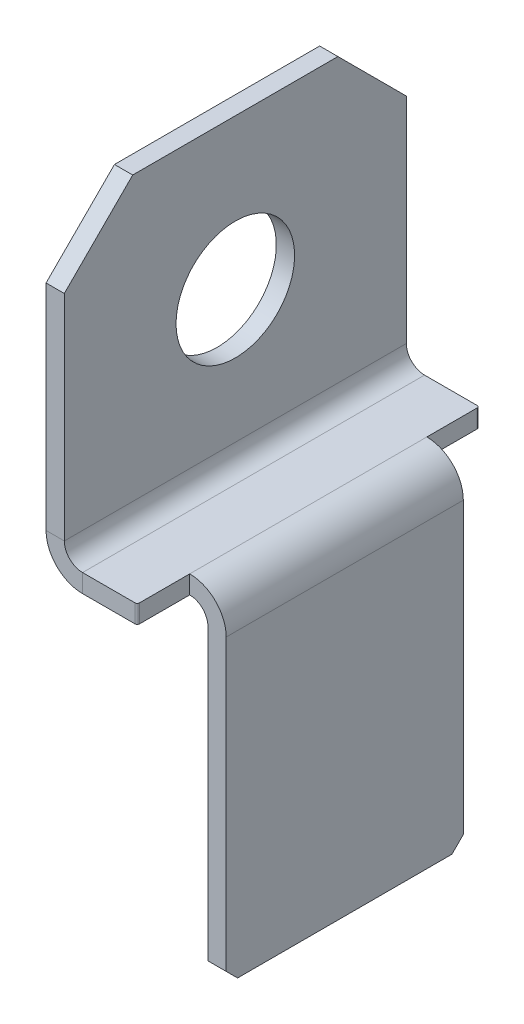
from build123d import *

# Parameters (mm, degrees)
ODGI_CIE_BAZOWE1_DEPTH          = 15
WYTNIJ_WYCI_GNI_CIE1_DEPTH      = 33.254612073
WYTNIJ_WYCI_GNI_CIE1_DEPTH_BACK = 1.6
SZKIC6_W                        = 2.3
SZKIC6_H                        = 1.6
SZKIC6_H_2                      = 13.2
WYTNIJ_WYCI_GNI_CIE2_REACH      = 34.255
SZKIC7_R                        = 2.6
SFAZOWANIE1_SIZE                = 3
ZAOKR_GLENIE1_R                 = 0.1
SFAZOWANIE2_SIZE                = 0.5


# Sheet-metal steps are written as plain solids
with BuildPart() as part:
    # Szkic1 → Odgięcie bazowe1 (new body)
    with BuildSketch(Plane.XY):
        with BuildLine():
            Line((0, 0), (0, 13.2))
            ThreePointArc((0, 13.2), (-0.234314575, 13.765685425), (-0.8, 14))
            Line((-0.8, 14), (-3.2, 14))
            ThreePointArc((-3.2, 14), (-4.33137085, 14.46862915), (-4.8, 15.6))
            Line((-4.8, 15.6), (-4.8, 28))
            Line((-4.8, 28), (-4, 28))
            Line((-4, 28), (-4, 15.6))
            ThreePointArc((-4, 15.6), (-3.765685425, 15.034314575), (-3.2, 14.8))
            Line((-3.2, 14.8), (-0.8, 14.8))
            ThreePointArc((-0.8, 14.8), (0.33137085, 14.33137085), (0.8, 13.2))
            Line((0.8, 13.2), (0.8, 0))
            Line((0.8, 0), (0, 0))
        make_face()
    extrude(amount=ODGI_CIE_BAZOWE1_DEPTH)

    # Szkic6 → Wytnij-wyciągnięcie1 (cut, two sides: drawn at the far end of the back side and taken through both)
    with BuildSketch(Plane(origin=(0.8, 0, 0), x_dir=(0, 0, -1), z_dir=(1, 0, 0)).offset(-WYTNIJ_WYCI_GNI_CIE1_DEPTH_BACK)):
        with Locations((-13.85, 14)):
            Rectangle(SZKIC6_W, SZKIC6_H)
        with Locations((-1.15, 14)):
            Rectangle(SZKIC6_W, SZKIC6_H)
        with Locations((-1.15, 6.6)):
            Rectangle(SZKIC6_W, SZKIC6_H_2)
        with Locations((-13.85, 6.6)):
            Rectangle(SZKIC6_W, SZKIC6_H_2)
    extrude(amount=WYTNIJ_WYCI_GNI_CIE1_DEPTH + WYTNIJ_WYCI_GNI_CIE1_DEPTH_BACK, mode=Mode.SUBTRACT)

    # Szkic7 → Wytnij-wyciągnięcie2 (cut, up to next)
    with BuildSketch(Plane.ZY.offset(4.8), mode=Mode.PRIVATE) as wytnij_wyci_gni_cie2_sk1:
        with Locations((7.5, 21.4)):
            Circle(SZKIC7_R)
    wytnij_wyci_gni_cie2_tool1 = extrude(wytnij_wyci_gni_cie2_sk1.sketch, amount=-WYTNIJ_WYCI_GNI_CIE2_REACH, mode=Mode.PRIVATE) & part.part
    add(wytnij_wyci_gni_cie2_tool1.solids().sort_by_distance((-4.8, 21.4, 7.5))[0], mode=Mode.SUBTRACT)

    # Sfazowanie1
    sfazowanie1_edges = [part.edges().sort_by_distance(p)[0] for p in [
        (-4.4, 28, 0),
        (-4.4, 28, 15),
    ]]
    chamfer(sfazowanie1_edges, length=SFAZOWANIE1_SIZE)

    # Zaokrąglenie1
    zaokr_glenie1_edges = [part.edges().sort_by_distance(p)[0] for p in [
        (-0.8, 14.4, 0),
        (-0.8, 14.4, 15),
    ]]
    fillet(zaokr_glenie1_edges, radius=ZAOKR_GLENIE1_R)

    # Sfazowanie2
    sfazowanie2_edges = [part.edges().sort_by_distance(p)[0] for p in [
        (0.4, 0, 2.3),
        (0.4, 0, 12.7),
    ]]
    chamfer(sfazowanie2_edges, length=SFAZOWANIE2_SIZE)


solid = part.part
